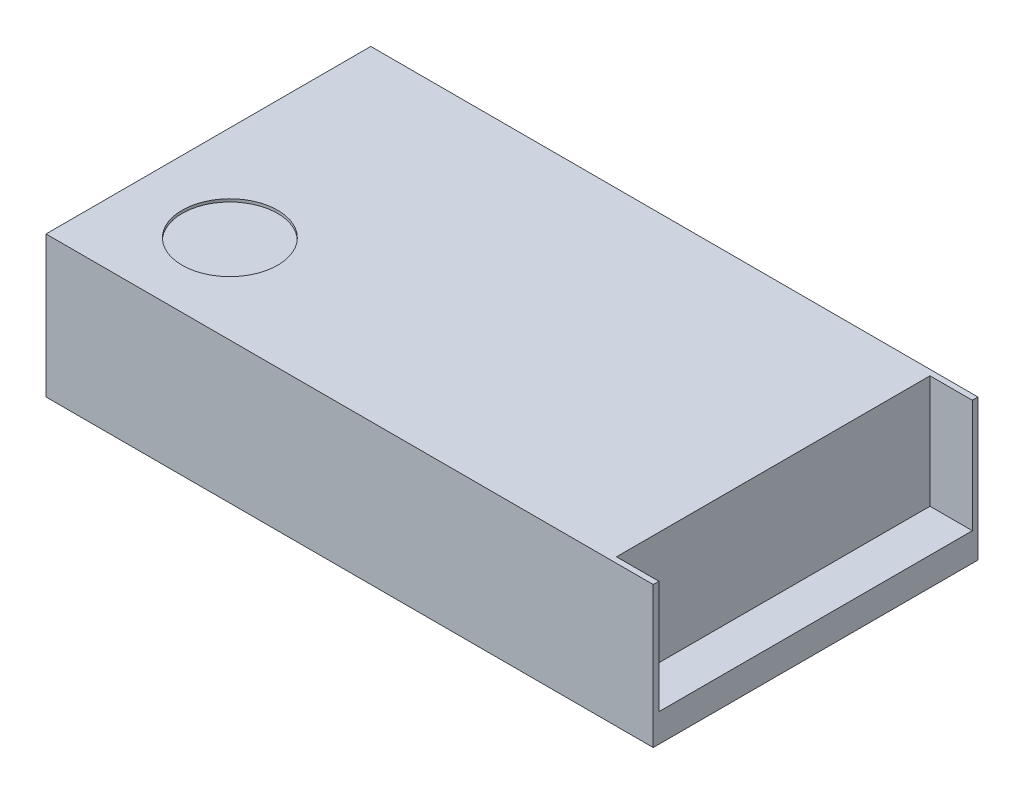
from build123d import *

# Parameters (mm, degrees)
SKETCH1_W           = 215
SKETCH1_H           = 115
BOSS_EXTRUDE1_DEPTH = 50
SKETCH2_R           = 16.899563319
CUT_EXTRUDE1_DEPTH  = 1
SKETCH4_W           = 15
SKETCH4_H           = 111
CUT_EXTRUDE2_DEPTH  = 40


with BuildPart() as part:
    # Sketch1 → Boss-Extrude1 (new body)
    with BuildSketch(Plane(origin=(0, 0, 0), x_dir=(1, 0, 0), z_dir=(0, 1, 0))):
        Rectangle(SKETCH1_W, SKETCH1_H)
    extrude(amount=BOSS_EXTRUDE1_DEPTH)

    # Sketch2 → Cut-Extrude1 (cut)
    with BuildSketch(Plane(origin=(0, 50, 0), x_dir=(1, 0, 0), z_dir=(0, 1, 0))):
        with Locations((-73.794759825, -26.100436681)):
            Circle(SKETCH2_R)
    extrude(amount=-CUT_EXTRUDE1_DEPTH, mode=Mode.SUBTRACT)

    # Sketch4 → Cut-Extrude2 (cut)
    with BuildSketch(Plane(origin=(0, 50, 0), x_dir=(1, 0, 0), z_dir=(0, 1, 0))):
        with Locations((100, 0)):
            Rectangle(SKETCH4_W, SKETCH4_H)
    extrude(amount=-CUT_EXTRUDE2_DEPTH, mode=Mode.SUBTRACT)


solid = part.part
